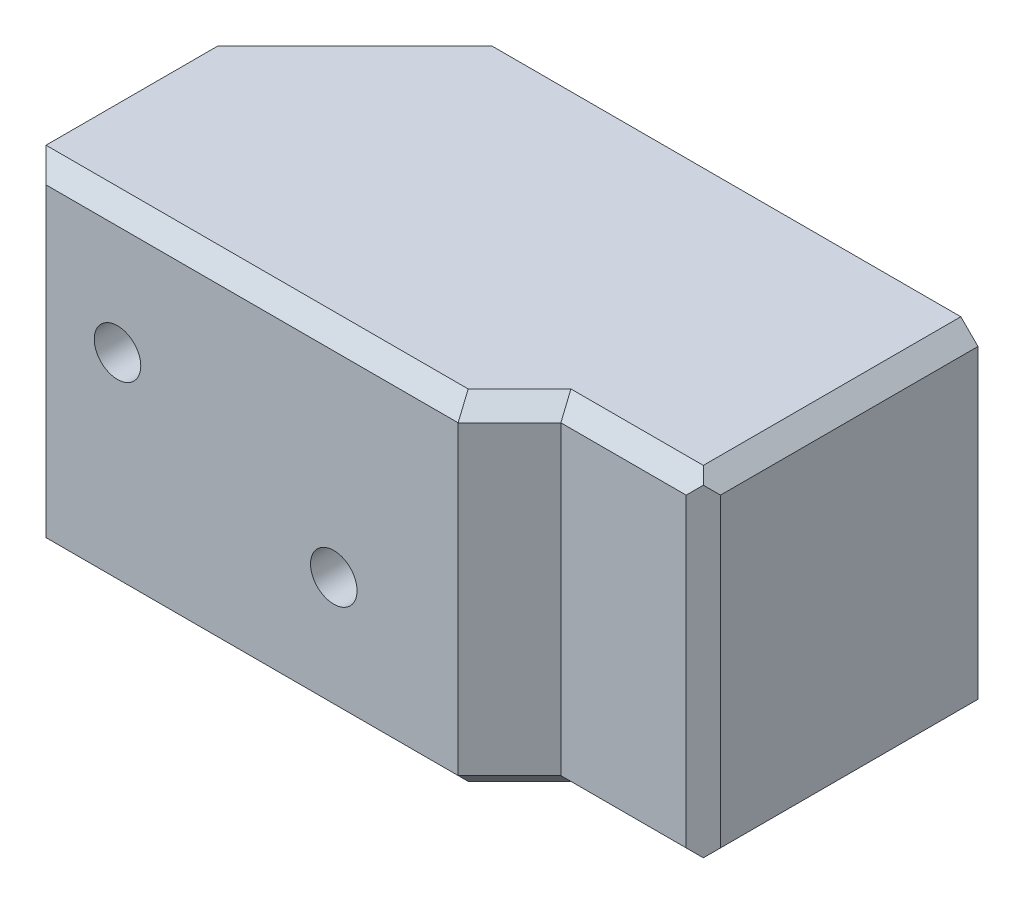
from build123d import *

# Parameters (mm, degrees)
SKETCH1_W             = 54.45
SKETCH1_H             = 20
BOSS_EXTRUDE1_DEPTH   = 3.175
BOSS_EXTRUDE2_DEPTH   = 54.45
SKETCH3_W             = 25.4
SKETCH3_H             = 31.43
BOSS_EXTRUDE3_DEPTH   = 3.175
CHAMFER1_SIZE         = 1.5875
CHAMFER2_SIZE         = 12.7
SKETCH5_W             = 31.75
SKETCH5_H             = 31.43
BOSS_EXTRUDE5_DEPTH   = 4.7498
CHAMFER3_SIZE         = 12.7
CHAMFER4_SIZE         = 1.5875
F_6_CLEARANCE_HOLE1_D = 4.3053


with BuildPart() as part:
    # Sketch1 → Boss-Extrude1 (new body)
    with BuildSketch(Plane.XY):
        with Locations((29.025, 8.610649597)):
            Rectangle(SKETCH1_W, SKETCH1_H)
    extrude(amount=BOSS_EXTRUDE1_DEPTH)

    # Sketch2 → Boss-Extrude2 (add)
    with BuildSketch(Plane(origin=(56.25, 0, 0), x_dir=(0, 0, -1), z_dir=(1, 0, 0))):
        Polygon((0, 18.610649597), (0, 21.150649597), (22.225, 21.150649597), (22.225, 24.325649597), (-3.175, 24.325649597), (-3.175, 18.610649597), align=None)
        Polygon((22.225, -3.929350403), (22.225, -7.104350403), (-3.175, -7.104350403), (-3.175, -1.389350403), (0, -1.389350403), (0, -3.929350403), align=None)
    extrude(amount=-BOSS_EXTRUDE2_DEPTH)

    # Sketch3 → Boss-Extrude3 (add)
    with BuildSketch(Plane(origin=(56.25, 0, 0), x_dir=(0, 0, -1), z_dir=(1, 0, 0))):
        with Locations((9.525, 8.610649597)):
            Rectangle(SKETCH3_W, SKETCH3_H)
    extrude(amount=BOSS_EXTRUDE3_DEPTH)

    # Chamfer1
    chamfer1_edges = [part.edges().sort_by_distance(p)[0] for p in [
        (29.025, 21.150649597, 0),
        (56.25, 21.150649597, -11.1125),
        (29.025, -3.929350403, 0),
        (56.25, -3.929350403, -11.1125),
        (59.425, 8.610649597, 3.175),
        (59.425, -7.104350403, -9.525),
        (59.425, 24.325649597, -9.525),
        (56.25, 8.610649597, 0),
    ]]
    chamfer(chamfer1_edges, length=CHAMFER1_SIZE)

    # Chamfer2
    chamfer2_edges = [part.edges().sort_by_distance(p)[0] for p in [
        (1.8, 22.738149597, -22.225),
        (1.8, -5.516850403, -22.225),
    ]]
    chamfer(chamfer2_edges, length=CHAMFER2_SIZE)

    # Sketch5 → Boss-Extrude5 (add)
    with BuildSketch(Plane.XY.offset(3.175)):
        with Locations((17.675, 8.610649597)):
            Rectangle(SKETCH5_W, SKETCH5_H)
    extrude(amount=BOSS_EXTRUDE5_DEPTH)

    # Chamfer3
    # the kernel refuses this chamfer: 12.7 mm, written as the material it adds along each edge
    with BuildSketch(Plane(origin=(33.55, 24.325649597, 3.175), x_dir=(0.9996219169112966, 0, -0.02749587661058638), z_dir=(0, -1, 0))) as chamfer3_piece_1_section:
        Polygon((CHAMFER3_SIZE * 0.999621916911, CHAMFER3_SIZE * 0.0274958766106), (-CHAMFER3_SIZE * 0.0274958766106, CHAMFER3_SIZE * 0.999621916911), (0, 0), align=None)
    chamfer3_piece_1 = extrude(amount=31.43, mode=Mode.PRIVATE)
    chamfer3_piece_1 = split(chamfer3_piece_1, bisect_by=Plane(origin=(38.87834153, 8.610649597, 7.9248), z_dir=(0, 0, -1)), keep=Keep.TOP, mode=Mode.PRIVATE)
    add(chamfer3_piece_1)

    # Chamfer4
    chamfer4_edges = [part.edges().sort_by_distance(p)[0] for p in [
        (21.6501, 24.325649597, 7.9248),
        (21.6501, -7.104350403, 7.9248),
        (1.8, 8.610649597, 7.9248),
        (52.04375, -7.104350403, 3.175),
        (52.04375, 24.325649597, 3.175),
        (43.8751, 24.325649597, 5.5499),
        (43.8751, -7.104350403, 5.5499),
    ]]
    chamfer(chamfer4_edges, length=CHAMFER4_SIZE)

    # #6 Clearance Hole1 (through all)
    with Locations(Plane.XY.offset(7.9248)):
        with Locations((10, 12.610649597), (30, 4.610649597)):
            Hole(F_6_CLEARANCE_HOLE1_D / 2)


solid = part.part
